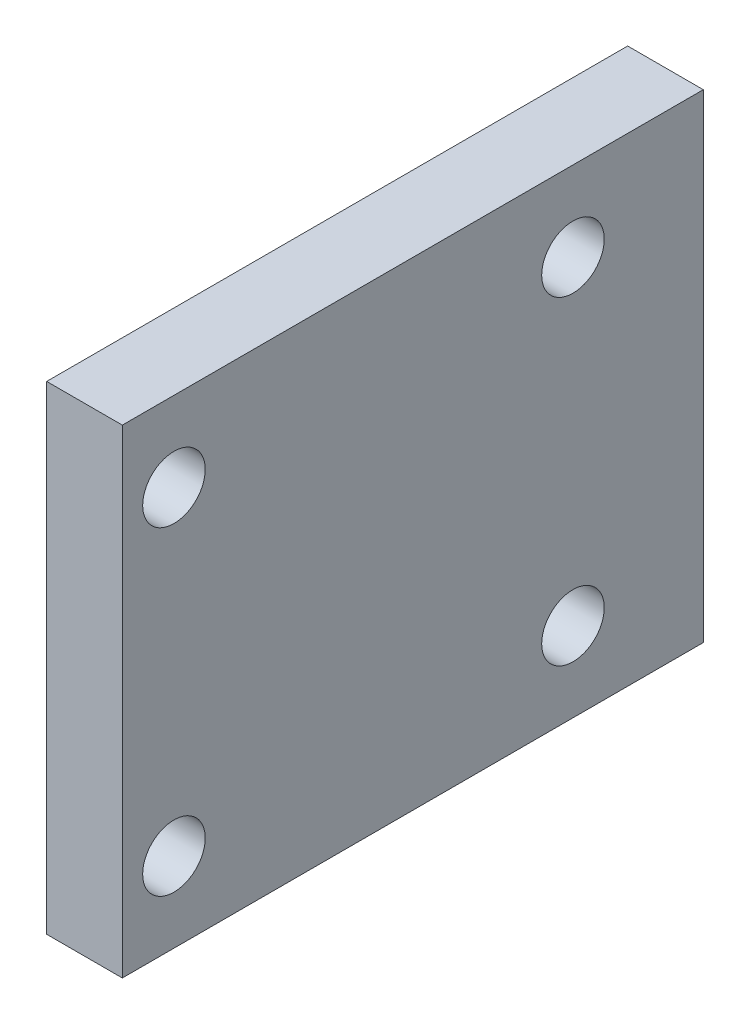
from build123d import *

# Parameters (mm, degrees)
SKETCH2_W                  = 46.228
SKETCH2_H                  = 38.1
BOSS_EXTRUDE1_DEPTH        = 6.0198
F_10_CLEARANCE_HOLE1_D     = 4.9784
F_10_CLEARANCE_HOLE1_DEPTH = 25.4
F_10_CLEARANCE_HOLE1_TIP   = 1.495662253


with BuildPart() as part:
    # Sketch2 → Boss-Extrude1 (new body)
    with BuildSketch(Plane(origin=(-488.965433296, 0, 0), x_dir=(0, 0, -1), z_dir=(1, 0, 0))):
        with Locations((171.873330939, 147.533779805)):
            Rectangle(SKETCH2_W, SKETCH2_H)
    extrude(amount=BOSS_EXTRUDE1_DEPTH)

    # #10 Clearance Hole1
    with Locations(Plane.ZY.offset(488.965433296)):
        with Locations((-184.616110941, 160.233779805), (-152.866110941, 160.233779805), (-152.866110941, 134.833779805), (-184.616110941, 134.833779805)):
            Hole(F_10_CLEARANCE_HOLE1_D / 2, depth=F_10_CLEARANCE_HOLE1_DEPTH)
            with Locations((0, 0, -(F_10_CLEARANCE_HOLE1_DEPTH + F_10_CLEARANCE_HOLE1_TIP / 2))):  # 118° drill point
                Cone(0, F_10_CLEARANCE_HOLE1_D / 2, F_10_CLEARANCE_HOLE1_TIP, mode=Mode.SUBTRACT)


solid = part.part
